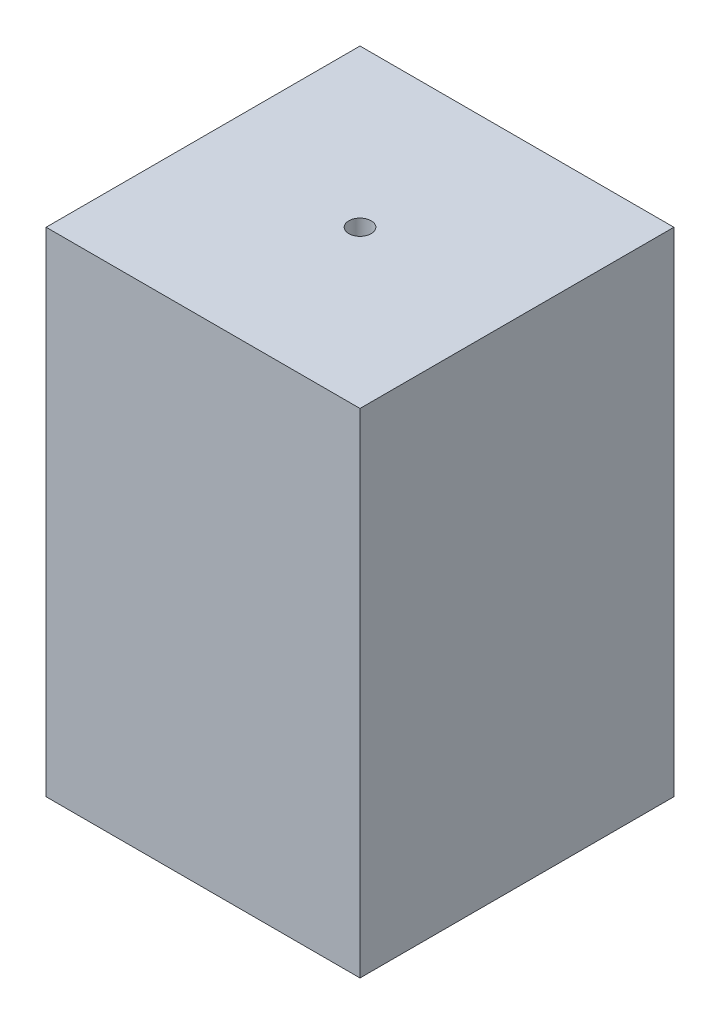
from build123d import *

# Parameters (mm, degrees)
SKETCH1_W           = 140
SKETCH1_H           = 140
SKETCH1_R           = 5
BOSS_EXTRUDE1_DEPTH = 10
SKETCH3_W           = 140
SKETCH3_H           = 140
SKETCH3_W_2         = 120
SKETCH3_H_2         = 120
BOSS_EXTRUDE2_DEPTH = 210


with BuildPart() as part:
    # Sketch1 → Boss-Extrude1 (new body)
    with BuildSketch(Plane(origin=(0, 0, 0), x_dir=(1, 0, 0), z_dir=(0, 1, 0))):
        Rectangle(SKETCH1_W, SKETCH1_H)
        Circle(SKETCH1_R, mode=Mode.SUBTRACT)
    extrude(amount=BOSS_EXTRUDE1_DEPTH)

    # Sketch3 → Boss-Extrude2 (add)
    with BuildSketch(Plane.XZ):
        Rectangle(SKETCH3_W, SKETCH3_H)
        Rectangle(SKETCH3_W_2, SKETCH3_H_2, mode=Mode.SUBTRACT)
    extrude(amount=BOSS_EXTRUDE2_DEPTH)


solid = part.part
